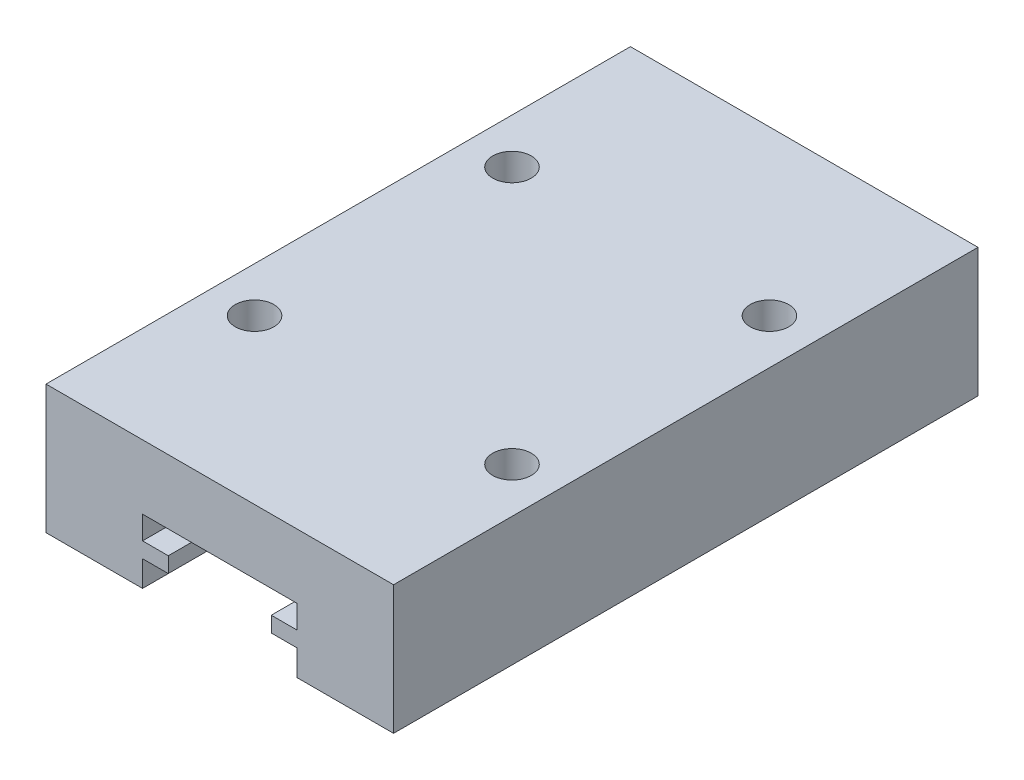
from build123d import *

# Parameters (mm, degrees)
BOSS_EXTRU_1_DEPTH      = 45.4
ESQUISSE2_R             = 1.5
ENL_V_MAT_EXTRU_1_DEPTH = 3.5


with BuildPart() as part:
    # Esquisse1 → Boss.-Extru.1 (new body)
    with BuildSketch(Plane.XY):
        Polygon((-22.795509579, 10), (4.204490421, 10), (4.204490421, 0), (-3.295509579, 0), (-3.295509579, 2), (-5.295509579, 2), (-5.295509579, 3.2), (-3.295509579, 3.2), (-3.295509579, 5), (-15.295509579, 5), (-15.295509579, 3.2), (-13.295509579, 3.2), (-13.295509579, 2), (-15.295509579, 2), (-15.295509579, 0), (-22.795509579, 0), align=None)
    extrude(amount=BOSS_EXTRU_1_DEPTH)

    # Esquisse2 → Enlèv. mat.-Extru.1 (cut)
    with BuildSketch(Plane(origin=(0, 10, 0), x_dir=(1, 0, 0), z_dir=(0, 1, 0))):
        with Locations((-19.295509579, -32.7)):
            Circle(ESQUISSE2_R)
        with Locations((-19.295509579, -12.7)):
            Circle(ESQUISSE2_R)
        with Locations((0.704490421, -12.7)):
            Circle(ESQUISSE2_R)
        with Locations((0.704490421, -32.7)):
            Circle(ESQUISSE2_R)
    extrude(amount=-ENL_V_MAT_EXTRU_1_DEPTH, mode=Mode.SUBTRACT)


solid = part.part
